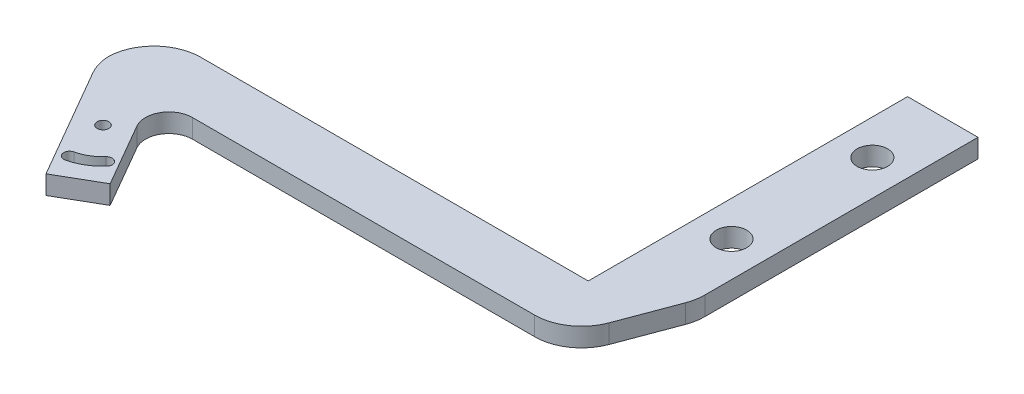
from build123d import *

# Parameters (mm, degrees)
BOSS_EXTRUDE1_DEPTH = 4
SKETCH2_W           = 92.5
SKETCH2_H           = 8
CUT_EXTRUDE1_DEPTH  = 187.792378648
SKETCH3_R           = 1.25
CUT_EXTRUDE2_DEPTH  = 187.792378648
SKETCH4_R           = 3.25
CUT_EXTRUDE3_DEPTH  = 187.792378648
FILLET1_R           = 10
FILLET2_R           = 5
CUT_EXTRUDE4_DEPTH  = 187.792378648


with BuildPart() as part:
    # Sketch1 → Boss-Extrude1 (new body)
    with BuildSketch(Plane(origin=(0, 0, 0), x_dir=(1, 0, 0), z_dir=(0, 1, 0))):
        Polygon((155.594010768, -30), (63.094010768, -30), (63.094010768, -50), (78.094010768, -75.980762114), (86.754264805, -70.980762114), (74.641016151, -50), (163.094010768, -50), (170.594010768, -30), (170.594010768, 30), (155.594010768, 30), align=None)
    extrude(amount=BOSS_EXTRUDE1_DEPTH)

    # Sketch2 → Cut-Extrude1 (cut, through all)
    with BuildSketch(Plane(origin=(0, 0, 0), x_dir=(1, 0, 0), z_dir=(0, 1, 0))):
        with Locations((109.344010768, -34)):
            Rectangle(SKETCH2_W, SKETCH2_H)
    extrude(amount=CUT_EXTRUDE1_DEPTH, mode=Mode.SUBTRACT)

    # Sketch3 → Cut-Extrude2 (cut, through all)
    with BuildSketch(Plane(origin=(0, 4, 0), x_dir=(1, 0, 0), z_dir=(0, 1, 0))):
        with Locations(Location((75.174137787, -60.923393759, 0), (0, 0, 270))):
            Circle(SKETCH3_R)
        with Locations(Location((79.924137787, -69.150635095, 0), (0, 0, 270))):
            Circle(SKETCH3_R)
    extrude(amount=-CUT_EXTRUDE2_DEPTH, mode=Mode.SUBTRACT)

    # Sketch4 → Cut-Extrude3 (cut, through all)
    with BuildSketch(Plane(origin=(0, 4, 0), x_dir=(1, 0, 0), z_dir=(0, 1, 0))):
        with Locations(Location((163.094010768, 15, 0), (0, 0, 270))):
            Circle(SKETCH4_R)
        with Locations(Location((163.094010768, -15, 0), (0, 0, 270))):
            Circle(SKETCH4_R)
    extrude(amount=-CUT_EXTRUDE3_DEPTH, mode=Mode.SUBTRACT)

    # Fillet1
    # the kernel refuses this fillet: 10 mm, written as the material it takes off along each edge
    with BuildSketch(Plane(origin=(63.094010768, -6.698729811, 50), x_dir=(0, 0, -1), z_dir=(0, 1, 0))) as fillet1_piece_1:
        with BuildLine():
            CenterArc((FILLET1_R * 0.267949192431, -FILLET1_R), FILLET1_R, 90, 30)
            Line((-FILLET1_R * 0.232050807569, -FILLET1_R * 0.133974596216), (0, 0))
            Line((0, 0), (FILLET1_R * 0.267949192431, 0))
        make_face()
    extrude(amount=17.397459622, mode=Mode.SUBTRACT)
    with BuildSketch(Plane(origin=(63.094010768, -25, 38), x_dir=(1, 0, 0), z_dir=(0, 1, 0))) as fillet1_piece_2:
        with BuildLine():
            CenterArc((FILLET1_R, -FILLET1_R), FILLET1_R, 90, 90)
            Line((0, -FILLET1_R), (0, 0))
            Line((0, 0), (FILLET1_R, 0))
        make_face()
    extrude(amount=54, mode=Mode.SUBTRACT)
    with BuildSketch(Plane(origin=(163.094010768, -17.325011704, 50), x_dir=(0.35112344158838954, 0, -0.9363291775690453), z_dir=(0, 1, 0))) as fillet1_piece_3:
        with BuildLine():
            CenterArc((FILLET1_R * 0.693000468165, FILLET1_R), FILLET1_R, 200.55604522, 69.44395478)
            Line((-FILLET1_R * 0.243328709404, FILLET1_R * 0.648876558412), (0, 0))
            Line((0, 0), (FILLET1_R * 0.693000468165, 0))
        make_face()
    extrude(amount=38.650023408, mode=Mode.SUBTRACT)
    with BuildSketch(Plane(origin=(170.594010768, -4.533364544, 30), x_dir=(0, 0, -1), z_dir=(0, 1, 0))) as fillet1_piece_4:
        with BuildLine():
            CenterArc((FILLET1_R * 0.181334581773, FILLET1_R), FILLET1_R, 249.44395478, 20.55604522)
            Line((-FILLET1_R * 0.169788859816, FILLET1_R * 0.063670822431), (0, 0))
            Line((0, 0), (FILLET1_R * 0.181334581773, 0))
        make_face()
    extrude(amount=13.066729089, mode=Mode.SUBTRACT)

    # Fillet2
    fillet2_edges = [part.edges().sort_by_distance(p)[0] for p in [
        (74.641016151, 2, 50),
    ]]
    fillet(fillet2_edges, radius=FILLET2_R)

    # Sketch5 → Cut-Extrude4 (cut, through all)
    with BuildSketch(Plane(origin=(0, 4, 0), x_dir=(1, 0, 0), z_dir=(0, 1, 0))):
        with BuildLine():
            ThreePointArc((83.16294466, -68.116547777), (80.630175188, -70.185907233), (77.592361621, -71.397871955))
            ThreePointArc((77.592361621, -71.397871955), (76.093210222, -70.461098192), (77.029983985, -68.961946793))
            ThreePointArc((77.029983985, -68.961946793), (79.361329281, -68.031834332), (81.305082597, -66.443721261))
            ThreePointArc((81.305082597, -66.443721261), (83.070426886, -66.351203487), (83.16294466, -68.116547777))
        make_face()
    extrude(amount=-CUT_EXTRUDE4_DEPTH, mode=Mode.SUBTRACT)


solid = part.part
